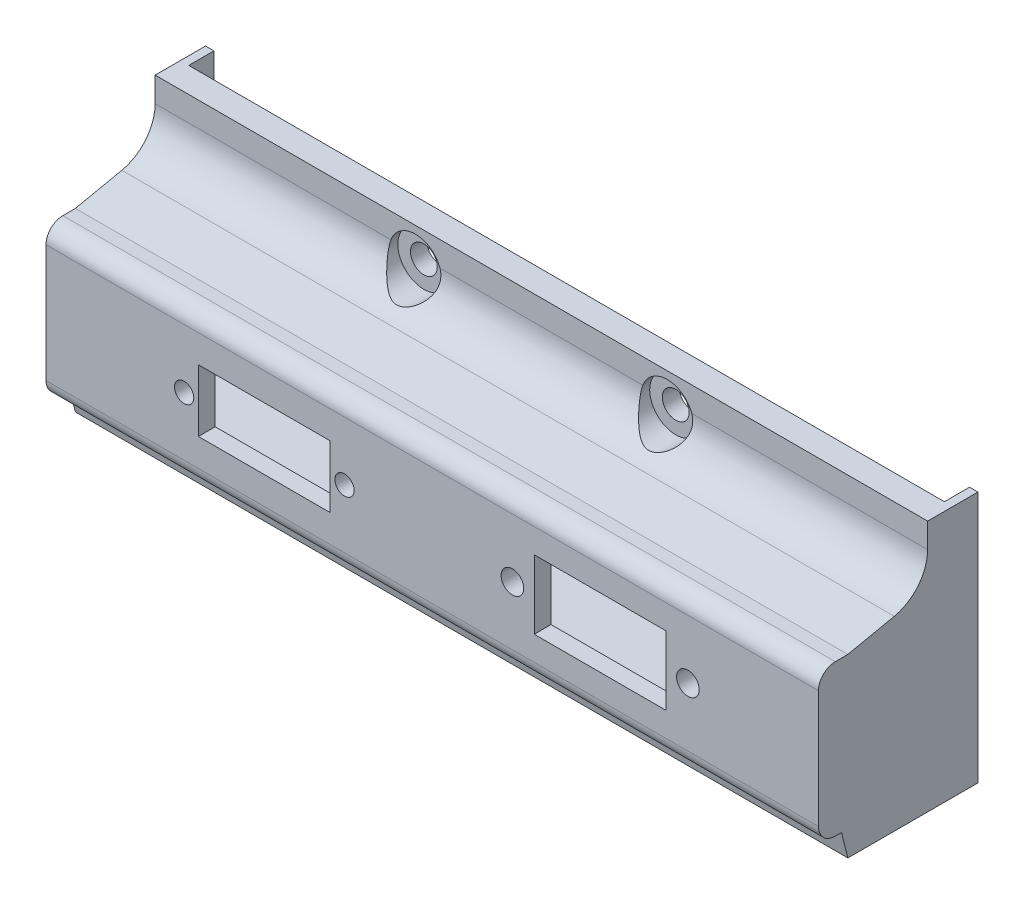
from build123d import *

# Parameters (mm, degrees)
SKETCH2_W               = 92
SKETCH2_H               = 30
BOSS_EXTRUDE1_DEPTH     = 16
SKETCH3_W               = 1
SKETCH3_H               = 30
BOSS_EXTRUDE2_DEPTH     = 3
SKETCH6_OUTSIDE_W       = 40.724
SKETCH6_OUTSIDE_H       = 51.724
CUT_EXTRUDE1_DEPTH      = 95.578010129
SKETCH7_R               = 1.6
CUT_EXTRUDE2_DEPTH      = 51.960769225
CUT_EXTRUDE3_DEPTH      = 51.0999002
CUT_EXTRUDE3_DEPTH_BACK = 1
SKETCH8_R               = 3.1
SHELL3_OUTLINE_W        = 88
SHELL3_OUTLINE_H        = 14
SHELL3_DEPTH            = 14
SHELL3_2_OUTLINE_W      = 88
SHELL3_2_OUTLINE_H      = 3
SHELL3_2_DEPTH          = 10.937428747
SHELL3_3_DEPTH          = 1
SHELL3_START            = -44
SHELL3_4_DEPTH          = 88
SHELL3_START_2          = 1
SHELL3_5_DEPTH          = 2.266756081
SKETCH9_R               = 1.35
SKETCH9_W               = 15.7
SKETCH9_H               = 8.2
CUT_EXTRUDE4_DEPTH      = 52.980765673
SKETCH10_R              = 1.15
SKETCH10_W              = 15.7
SKETCH10_H              = 7.4
CUT_EXTRUDE5_DEPTH      = 52.980765673
SKETCH11_R              = 1.55
CUT_EXTRUDE6_DEPTH      = 10
FILLET1_R               = 2
FILLET3_R               = 5


with BuildPart() as part:
    # Sketch2 → Boss-Extrude1 (new body)
    with BuildSketch(Plane.XY):
        Rectangle(SKETCH2_W, SKETCH2_H)
    extrude(amount=BOSS_EXTRUDE1_DEPTH)

    # Sketch3 → Boss-Extrude2 (add)
    with BuildSketch(Plane.XY):
        with Locations((45.5, 0)):
            Rectangle(SKETCH3_W, SKETCH3_H)
    boss_extrude2 = extrude(amount=-BOSS_EXTRUDE2_DEPTH)

    # Mirror1: Boss-Extrude2 across plane
    add(boss_extrude2.mirror(Plane(origin=(0, 0, 0), x_dir=(0, 0, 1), z_dir=(1, 0, 0))))

    # Sketch6 outside → Cut-Extrude1 (cut, through all)
    with BuildSketch(Plane(origin=(46, 0, 0), x_dir=(0, 0, -1), z_dir=(1, 0, 0))):
        with Locations((-6.5, 0)):
            Rectangle(SKETCH6_OUTSIDE_W, SKETCH6_OUTSIDE_H)
        Polygon((-12.5, 6), (-16, 6), (-16, -12), (-13.247984009, -12), (-12.5, -15), (3, -15), (3, 15), (-3, 15), (-3, 8), align=None, mode=Mode.SUBTRACT)
    extrude(amount=-CUT_EXTRUDE1_DEPTH, mode=Mode.SUBTRACT)

    # Sketch7 → Cut-Extrude2 (cut, through all)
    with BuildSketch(Plane.XY):
        with Locations((-15, 11)):
            Circle(SKETCH7_R)
        with Locations((15, 11)):
            Circle(SKETCH7_R)
    extrude(amount=CUT_EXTRUDE2_DEPTH, mode=Mode.SUBTRACT)

    # Sketch8 → Cut-Extrude3 (cut, two sides: drawn at the far end of the back side and taken through both)
    with BuildSketch(Plane.XY.offset(3).offset(-CUT_EXTRUDE3_DEPTH_BACK)):
        with Locations(Location((15, 11, 0), (0, 0, 255.407449398))):
            Circle(SKETCH8_R)
        with Locations(Location((-15, 11, 0), (0, 0, 255.407449398))):
            Circle(SKETCH8_R)
    extrude(amount=CUT_EXTRUDE3_DEPTH + CUT_EXTRUDE3_DEPTH_BACK, mode=Mode.SUBTRACT)

    # Shell3: read off the stored shape, not the designer's step
    # Shell3 outline → Shell3 (cut)
    with BuildSketch(Plane.XY):
        with Locations((0, -3)):
            Rectangle(SHELL3_OUTLINE_W, SHELL3_OUTLINE_H)
    extrude(amount=SHELL3_DEPTH, mode=Mode.SUBTRACT)

    # Shell3 2 outline → Shell3 2 (cut)
    with BuildSketch(Plane.XY):
        with Locations((0, -11.5)):
            Rectangle(SHELL3_2_OUTLINE_W, SHELL3_2_OUTLINE_H)
    extrude(amount=SHELL3_2_DEPTH, mode=Mode.SUBTRACT)

    # Shell3 3 outline → Shell3 3 (cut)
    with BuildSketch(Plane.XY):
        with BuildLine():
            Line((-19.691481642, 13), (-44, 13))
            Line((-44, 13), (-44, 4))
            Line((-44, 4), (44, 4))
            Line((44, 4), (44, 13))
            Line((44, 13), (19.691481642, 13))
            ThreePointArc((19.691481642, 13), (15, 5.9), (10.308518358, 13))
            Line((10.308518358, 13), (-10.308518358, 13))
            ThreePointArc((-10.308518358, 13), (-15, 5.9), (-19.691481642, 13))
        make_face()
    extrude(amount=SHELL3_3_DEPTH, mode=Mode.SUBTRACT)

    # Shell3 4 outline → Shell3 4 (cut)
    with BuildSketch(Plane.YZ.offset(SHELL3_START)):
        Polygon((4, 1), (6.377211806, 1), (4, 12.291756081), align=None)
        Polygon((-10, 10.937428747), (-10, 11.685412756), (-13, 10.937428747), align=None)
    extrude(amount=SHELL3_4_DEPTH, mode=Mode.SUBTRACT)

    # Shell3 5 outline → Shell3 5 (add)
    with BuildSketch(Plane.XY.offset(SHELL3_START_2)):
        with BuildLine():
            Line((17.154026303, 6.377211806), (12.845973697, 6.377211806))
            ThreePointArc((12.845973697, 6.377211806), (15, 5.9), (17.154026303, 6.377211806))
        make_face()
        with BuildLine():
            ThreePointArc((-17.154026303, 6.377211806), (-15, 5.9), (-12.845973697, 6.377211806))
            Line((-12.845973697, 6.377211806), (-17.154026303, 6.377211806))
        make_face()
    extrude(amount=SHELL3_5_DEPTH)

    # Sketch9 → Cut-Extrude4 (cut, through all)
    with BuildSketch(Plane.XY.offset(16)):
        with Locations((9.55, -3)):
            Circle(SKETCH9_R)
        with Locations((30.45, -3)):
            Circle(SKETCH9_R)
        with Locations((20, -3)):
            Rectangle(SKETCH9_W, SKETCH9_H)
    extrude(amount=-CUT_EXTRUDE4_DEPTH, mode=Mode.SUBTRACT)

    # Sketch10 → Cut-Extrude5 (cut, through all)
    with BuildSketch(Plane.XY.offset(16)):
        with Locations((-29.55, -3)):
            Circle(SKETCH10_R)
        with Locations((-10.45, -3)):
            Circle(SKETCH10_R)
        with Locations((-20, -3)):
            Rectangle(SKETCH10_W, SKETCH10_H)
    extrude(amount=-CUT_EXTRUDE5_DEPTH, mode=Mode.SUBTRACT)

    # Sketch11 → Cut-Extrude6 (cut)
    with BuildSketch(Plane.XZ.offset(15)):
        with Locations(Location((-20, 5, 0), (0, 0, 270))):
            Circle(SKETCH11_R)
        with Locations(Location((20, 5, 0), (0, 0, 270))):
            Circle(SKETCH11_R)
    extrude(amount=-CUT_EXTRUDE6_DEPTH, mode=Mode.SUBTRACT)

    # Fillet1
    fillet1_edges = [part.edges().sort_by_distance(p)[0] for p in [
        (0, -12, 16),
        (0, 6, 16),
    ]]
    fillet(fillet1_edges, radius=FILLET1_R)

    # Fillet3
    # the kernel refuses this fillet: 5 mm, written as the material it adds along each edge
    with BuildSketch(Plane(origin=(24.361401242, 8, 3), x_dir=(0, -0.20601048104984168, 0.978549784986749), z_dir=(-1, 0, 0))) as fillet3_piece_1_section:
        with BuildLine():
            CenterArc((FILLET3_R * 0.811394096787, FILLET3_R), FILLET3_R, 191.88865804, 78.11134196)
            Line((-FILLET3_R * 0.1671556882, FILLET3_R * 0.79398951895), (0, 0))
            Line((0, 0), (FILLET3_R * 0.811394096787, 0))
        make_face()
    fillet3_piece_1 = extrude(amount=48.722802484, mode=Mode.PRIVATE)
    fillet3_piece_1 = fillet3_piece_1 - Plane(origin=(-15, 11, 3), x_dir=(-0.2519435379319081, -0.967741935484018, 0), z_dir=(0, 0, -1)) * Cylinder(3.1, 114, mode=Mode.PRIVATE)
    fillet3_piece_1 = fillet3_piece_1 - Plane(origin=(15, 11, 3), x_dir=(-0.2519435379319081, -0.967741935484018, 0), z_dir=(0, 0, -1)) * Cylinder(3.1, 114, mode=Mode.PRIVATE)
    add(fillet3_piece_1)
    with BuildSketch(Plane(origin=(46, 8, 3), x_dir=(0, -0.20601048104984168, 0.978549784986749), z_dir=(-1, 0, 0))) as fillet3_piece_2_section:
        with BuildLine():
            CenterArc((FILLET3_R * 0.811394096787, FILLET3_R), FILLET3_R, 191.88865804, 78.11134196)
            Line((-FILLET3_R * 0.1671556882, FILLET3_R * 0.79398951895), (0, 0))
            Line((0, 0), (FILLET3_R * 0.811394096787, 0))
        make_face()
    fillet3_piece_2 = extrude(amount=40.361401242, mode=Mode.PRIVATE)
    fillet3_piece_2 = fillet3_piece_2 - Plane(origin=(15, 11, 3), x_dir=(-0.2519435379319081, -0.967741935484018, 0), z_dir=(0, 0, -1)) * Cylinder(3.1, 97, mode=Mode.PRIVATE)
    add(fillet3_piece_2)
    with BuildSketch(Plane(origin=(-5.638598758, 8, 3), x_dir=(0, -0.20601048104984168, 0.978549784986749), z_dir=(-1, 0, 0))) as fillet3_piece_3_section:
        with BuildLine():
            CenterArc((FILLET3_R * 0.811394096787, FILLET3_R), FILLET3_R, 191.88865804, 78.11134196)
            Line((-FILLET3_R * 0.1671556882, FILLET3_R * 0.79398951895), (0, 0))
            Line((0, 0), (FILLET3_R * 0.811394096787, 0))
        make_face()
    fillet3_piece_3 = extrude(amount=40.361401242, mode=Mode.PRIVATE)
    fillet3_piece_3 = fillet3_piece_3 - Plane(origin=(-15, 11, 3), x_dir=(-0.2519435379319081, -0.967741935484018, 0), z_dir=(0, 0, -1)) * Cylinder(3.1, 97, mode=Mode.PRIVATE)
    add(fillet3_piece_3)


solid = part.part
